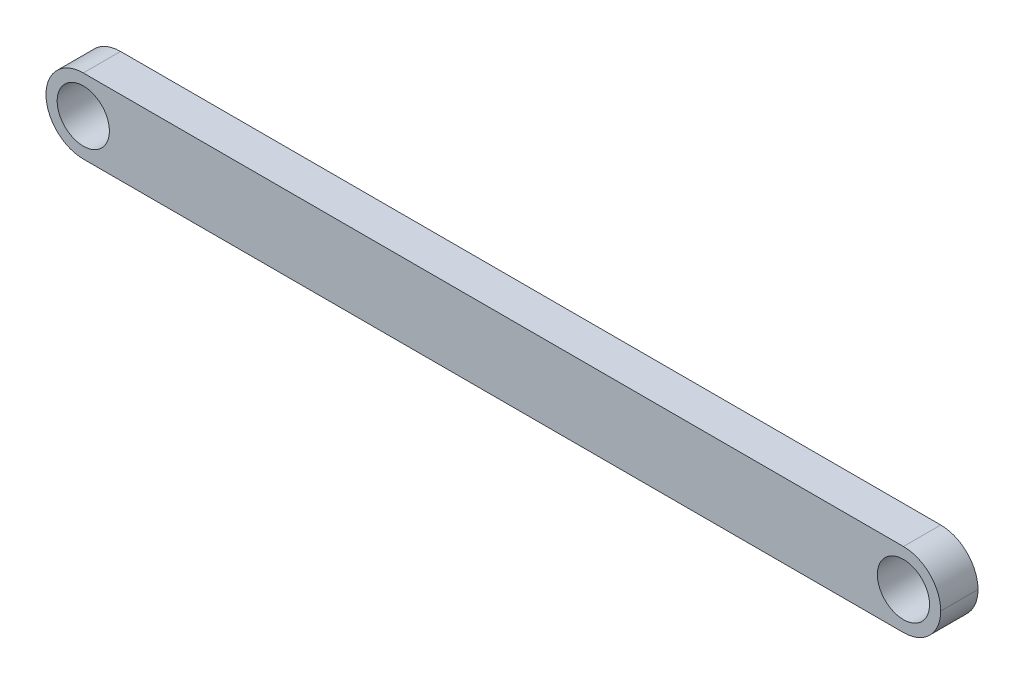
from build123d import *

# Parameters (mm, degrees)
SKETCH_1_W      = 240
SKETCH_1_H      = 20
SKETCH_1_R      = 7
EXTRUDE_1_DEPTH = 10
FILLET_1_R      = 10


with BuildPart() as part:
    # 草图1 → 凸台-拉伸1 (new body)
    with BuildSketch(Plane.XY):
        Rectangle(SKETCH_1_W, SKETCH_1_H)
        with Locations((-110, 0)):
            Circle(SKETCH_1_R, mode=Mode.SUBTRACT)
        with Locations((110, 0)):
            Circle(SKETCH_1_R, mode=Mode.SUBTRACT)
    extrude(amount=EXTRUDE_1_DEPTH)

    # 圆角1
    fillet_1_edges = [part.edges().sort_by_distance(p)[0] for p in [
        (120, 10, 5),
        (120, -10, 5),
        (-120, -10, 5),
        (-120, 10, 5),
    ]]
    fillet(fillet_1_edges, radius=FILLET_1_R - 0.0001)  # a hair under: the kernel refuses the full size


solid = part.part
